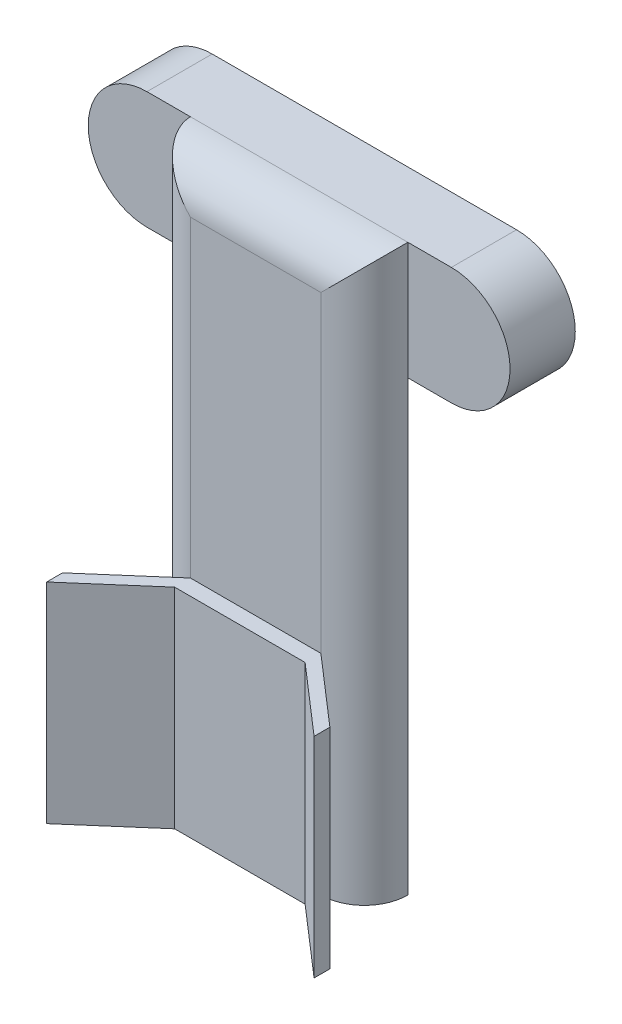
from build123d import *

# Parameters (mm, degrees)
EXTRUDE1_DEPTH = 15
SKETCH2_W      = 50
SKETCH2_H      = 130
EXTRUDE2_DEPTH = 10
FILLET1_R      = 10
SKETCH3_W      = 30
SKETCH3_H      = 48.133793791
EXTRUDE3_DEPTH = 8
SKETCH4_W      = 15
SKETCH4_H      = 3.631833837
EXTRUDE4_DEPTH = 48.133793792


with BuildPart() as part:
    # Sketch1 → Extrude1 (new body)
    with BuildSketch(Plane.XY):
        with BuildLine():
            Line((50, 198.565015772), (-20, 198.565015772))
            ThreePointArc((-20, 198.565015772), (-33.5, 212.065015772), (-20, 225.565015772))
            Line((-20, 225.565015772), (50, 225.565015772))
            ThreePointArc((50, 225.565015772), (63.5, 212.065015772), (50, 198.565015772))
        make_face()
    extrude(amount=EXTRUDE1_DEPTH)

    # Sketch2 → Extrude2 (add)
    with BuildSketch(Plane.XY.offset(15)):
        with Locations((15, 160.565015772)):
            Rectangle(SKETCH2_W, SKETCH2_H)
    extrude(amount=EXTRUDE2_DEPTH)

    # Fillet1
    fillet1_edges = [part.edges().sort_by_distance(p)[0] for p in [
        (40, 160.565015772, 25),
        (-10, 160.565015772, 25),
        (15, 225.565015772, 25),
    ]]
    fillet(fillet1_edges, radius=FILLET1_R - 0.0001)  # a hair under: the kernel refuses the full size

    # Sketch3 → Extrude3 (cut)
    with BuildSketch(Plane.XY.offset(25)):
        with Locations((15, 119.631912668)):
            Rectangle(SKETCH3_W, SKETCH3_H)
    extrude(amount=-EXTRUDE3_DEPTH, mode=Mode.SUBTRACT)

    # Sketch4 → Extrude4 (add)
    with BuildSketch(Plane.XZ.offset(-143.698809563)):
        Polygon((30, 17), (30, 25), (15, 25), (0, 25), (0, 17), align=None)
        with Locations((22.5, 26.815916919)):
            Rectangle(SKETCH4_W, SKETCH4_H)
        with Locations((7.5, 26.815916919)):
            Rectangle(SKETCH4_W, SKETCH4_H)
        Polygon((0, 25), (0, 28.631833837), (-15.741772737, 42.308009261), (-15.741772737, 38.676175424), align=None)
        Polygon((45.741772737, 42.308009261), (45.741772737, 38.676175424), (30, 25), (30, 28.631833837), align=None)
    extrude(amount=EXTRUDE4_DEPTH)


solid = part.part
